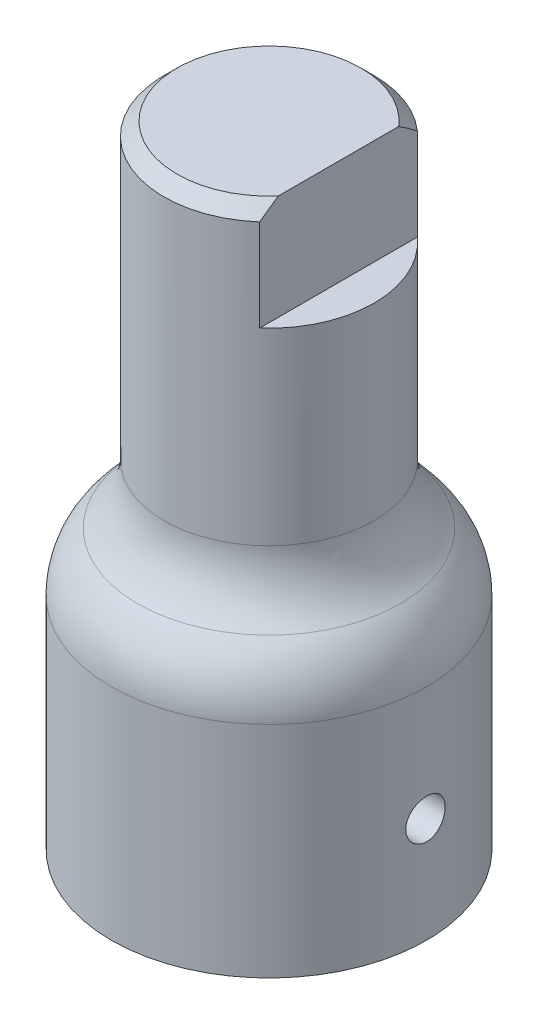
from build123d import *

# Parameters (mm, degrees)
SKETCH1_R           = 9.525
MALE_END_DEPTH      = 15.875
SKETCH2_R           = 6.35
FEMALE_END_DEPTH    = 38.1
UPPER_R             = 4.7625
LOWER_R             = 4.7625
D_CUT_DEPTH         = 12.7
SET_HOLE_REACH      = 43.858
SET_HOLE_END_RADIUS = 9.525
SKETCH5_R           = 1.190625
D_START             = -6.35
D_BOSS_DEPTH        = 6.35
EDGE_CHAMFER_SIZE   = 0.79375


with BuildPart() as part:
    # Sketch1 → male end (new body)
    with BuildSketch(Plane(origin=(0, 0, 0), x_dir=(1, 0, 0), z_dir=(0, 1, 0))):
        with Locations(Location((0, 0, 0), (0, 0, 270))):
            Circle(SKETCH1_R)
    extrude(amount=MALE_END_DEPTH)

    # Sketch2 → female end (add)
    with BuildSketch(Plane(origin=(0, 0, 0), x_dir=(-1, 0, 0), z_dir=(0, 1, 0))):
        with Locations(Location((0, 0, 0), (0, 0, 270))):
            Circle(SKETCH2_R)
    extrude(amount=FEMALE_END_DEPTH)

    # upper
    # the kernel refuses this fillet: 4.7625 mm, written as the material it adds along each edge
    with BuildSketch(Plane(origin=(0, 15.875, 0), x_dir=(0, 0, -1), z_dir=(-1, 0, 0))) as upper_piece_1:
        with BuildLine():
            CenterArc((11.1125, -4.490128061), UPPER_R, 109.471220634, 70.528779366)
            Line((6.35, -4.490128061), (6.25475, -4.490128061))
            Line((6.25475, -4.490128061), (6.25475, 0))
            Line((6.25475, 0), (6.35, 0.09525))
            ThreePointArc((6.35, 0.09525), (7.9375, 0.09525), (9.49325, 0.089802561))
            Line((9.49325, 0.089802561), (9.525, 0))
        make_face()
    revolve(axis=Axis((0, 15.875, 0), (0, -1, 0)))

    # lower
    lower_edges = [part.edges().sort_by_distance(p)[0] for p in [
        (9.525, 15.875, 0),
    ]]
    fillet(lower_edges, radius=LOWER_R)

    # Sketch3 → D cut (cut)
    with BuildSketch(Plane.XZ):
        with BuildLine():
            Line((4.956967161, -3.96875), (4.956967161, 3.96875))
            ThreePointArc((4.956967161, 3.96875), (-6.35, 0), (4.956967161, -3.96875))
        make_face()
    extrude(amount=-D_CUT_DEPTH, mode=Mode.SUBTRACT)

    # set hole: up to this cylinder (the profile starts inside it)
    set_hole_end = Plane(origin=(0, 6.35, 0), z_dir=(0, -1, 0)) * Cylinder(SET_HOLE_END_RADIUS, 107.766, mode=Mode.PRIVATE)
    # Sketch5 → set hole (cut, up to the surface)
    with BuildSketch(Plane.ZY.offset(-4.956967161), mode=Mode.PRIVATE) as set_hole_sk1:
        with Locations((0, 6.35)):
            Circle(SKETCH5_R)
    set_hole_tool1 = extrude(set_hole_sk1.sketch, amount=-SET_HOLE_REACH, mode=Mode.PRIVATE) & set_hole_end
    add(set_hole_tool1.solids().sort_by_distance((4.956967, 6.35, 0))[0], mode=Mode.SUBTRACT)

    # Sketch4 → D boss (cut)
    with BuildSketch(Plane(origin=(0, 38.1, 0), x_dir=(-1, 0, 0), z_dir=(0, 1, 0)).offset(D_START)):
        with BuildLine():
            Line((-4.200130206, 4.7625), (-4.200130206, -4.7625))
            ThreePointArc((-4.200130206, -4.7625), (-6.35, 0), (-4.200130206, 4.7625))
        make_face()
    extrude(amount=D_BOSS_DEPTH, mode=Mode.SUBTRACT)

    # edge chamfer
    edge_chamfer_edges = [part.edges().sort_by_distance(p)[0] for p in [
        (-5.939881102, 38.1, 2.24506403),
    ]]
    chamfer(edge_chamfer_edges, length=EDGE_CHAMFER_SIZE)


solid = part.part
